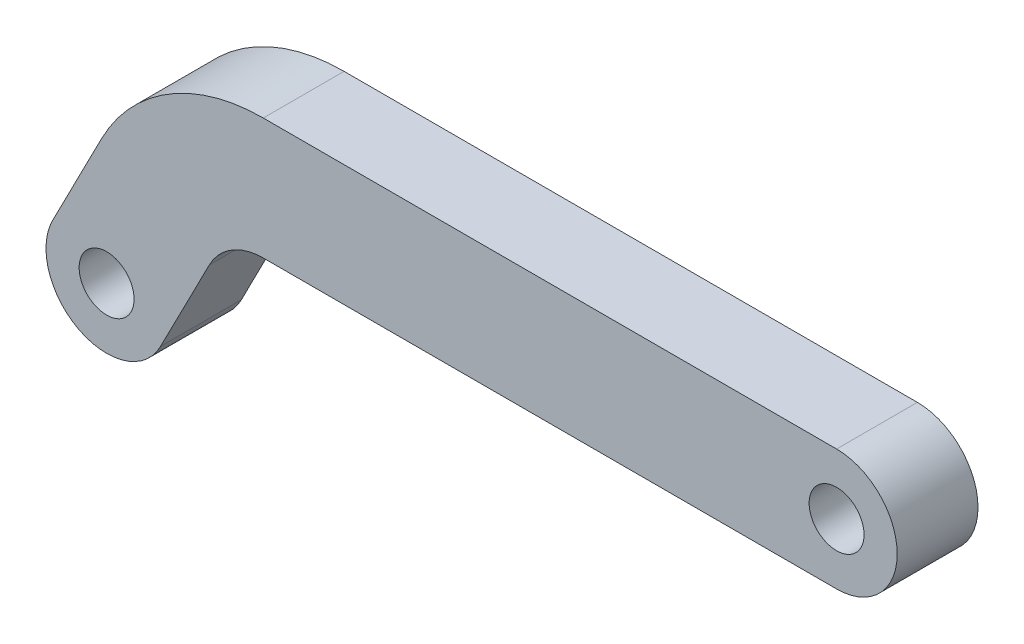
from build123d import *

# Parameters (mm, degrees)
SKETCH1_R           = 2.159
BOSS_EXTRUDE1_DEPTH = 3.175


with BuildPart() as part:
    # Sketch1 → Boss-Extrude1 (new, symmetric)
    with BuildSketch(Plane.XY):
        with BuildLine():
            Line((57.36017888, 17.407806841), (12.310714245, 17.407806841))
            ThreePointArc((12.310714245, 17.407806841), (4.865384811, 15.314556546), (-0.398326, 9.648166543))
            Line((-0.398326, 9.648166543), (-4.236346748, 2.175953234))
            ThreePointArc((-4.236346748, 2.175953234), (-2.175953234, -4.236346748), (4.236346748, -2.175953234))
            Line((4.236346748, -2.175953234), (8.074367496, 5.296260075))
            ThreePointArc((8.074367496, 5.296260075), (9.828937767, 7.185056743), (12.310714245, 7.882806841))
            Line((12.310714245, 7.882806841), (57.36017888, 7.882806841))
            ThreePointArc((57.36017888, 7.882806841), (62.12267888, 12.645306841), (57.36017888, 17.407806841))
        make_face()
        Circle(SKETCH1_R, mode=Mode.SUBTRACT)
        with Locations((57.36017888, 12.645306841)):
            Circle(SKETCH1_R, mode=Mode.SUBTRACT)
    extrude(amount=BOSS_EXTRUDE1_DEPTH, both=True)


solid = part.part
